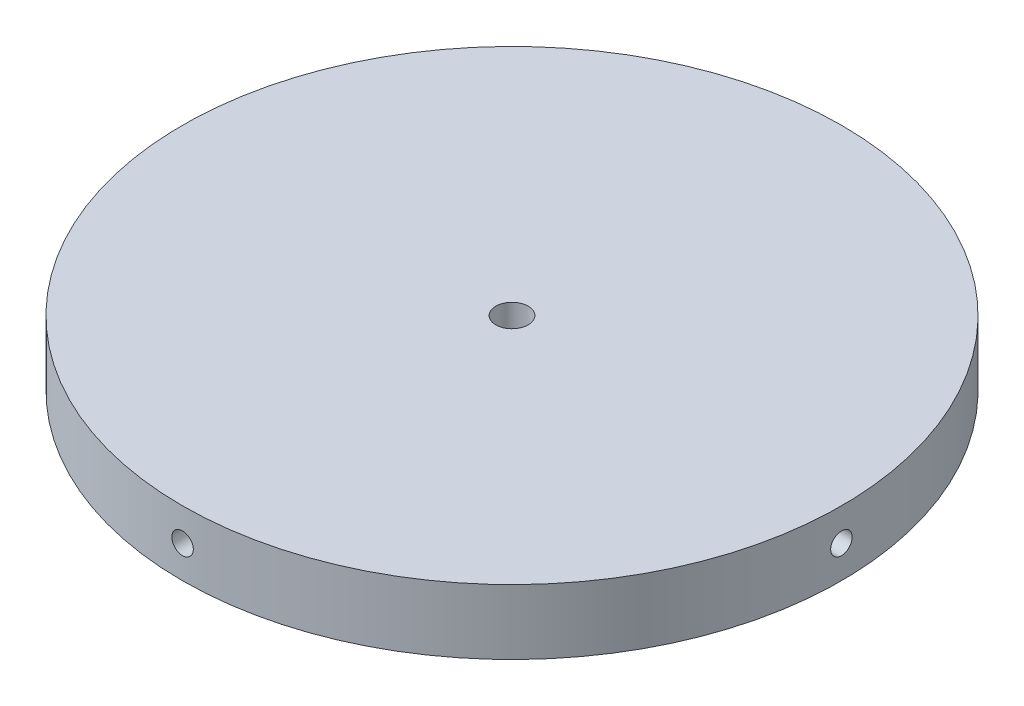
from build123d import *

# Parameters (mm, degrees)
SKETCH1_R                       = 50.7746
BOSS_EXTRUDE1_DEPTH             = 5
M6_TAPPED_HOLE1_D               = 5
M4_TAPPED_HOLE1_D               = 3.3
M4_TAPPED_HOLE1_DEPTH           = 10.1
M4_TAPPED_HOLE1_TIP             = 0.991420021
M4_TAPPED_HOLE1_ON_FACE_2_D     = 3.3
M4_TAPPED_HOLE1_ON_FACE_2_DEPTH = 10.1
M4_TAPPED_HOLE1_ON_FACE_2_TIP   = 0.991420021
M4_TAPPED_HOLE1_ON_FACE_3_D     = 3.3
M4_TAPPED_HOLE1_ON_FACE_3_DEPTH = 10.1
M4_TAPPED_HOLE1_ON_FACE_3_TIP   = 0.991420021
M4_TAPPED_HOLE1_ON_FACE_4_D     = 3.3
M4_TAPPED_HOLE1_ON_FACE_4_DEPTH = 10.1
M4_TAPPED_HOLE1_ON_FACE_4_TIP   = 0.991420021


with BuildPart() as part:
    # Sketch1 → Boss-Extrude1 (new, symmetric)
    with BuildSketch(Plane(origin=(0, 0, 0), x_dir=(1, 0, 0), z_dir=(0, 1, 0))):
        Circle(SKETCH1_R)
    extrude(amount=BOSS_EXTRUDE1_DEPTH, both=True)

    # M6 Tapped Hole1 (through all)
    with Locations(Plane(origin=(0, 5, 0), x_dir=(1, 0, 0), z_dir=(0, 1, 0))):
        with Locations((0, 0)):
            Hole(M6_TAPPED_HOLE1_D / 2)

    # M4 Tapped Hole1
    with Locations(Plane(origin=(0, 0, -50.7746), x_dir=(-1, 0, 0), z_dir=(0, 0, -1))):
        with Locations((0, 0)):
            Hole(M4_TAPPED_HOLE1_D / 2, depth=M4_TAPPED_HOLE1_DEPTH)
            with Locations((0, 0, -(M4_TAPPED_HOLE1_DEPTH + M4_TAPPED_HOLE1_TIP / 2))):  # 118° drill point
                Cone(0, M4_TAPPED_HOLE1_D / 2, M4_TAPPED_HOLE1_TIP, mode=Mode.SUBTRACT)

    # M4 Tapped Hole1 on face 2
    with Locations(Plane(origin=(-50.7746, 0, 0), x_dir=(0, 0, -1), z_dir=(-1, 0, 0))):
        with Locations((0, 0)):
            Hole(M4_TAPPED_HOLE1_ON_FACE_2_D / 2, depth=M4_TAPPED_HOLE1_ON_FACE_2_DEPTH)
            with Locations((0, 0, -(M4_TAPPED_HOLE1_ON_FACE_2_DEPTH + M4_TAPPED_HOLE1_ON_FACE_2_TIP / 2))):  # 118° drill point
                Cone(0, M4_TAPPED_HOLE1_ON_FACE_2_D / 2, M4_TAPPED_HOLE1_ON_FACE_2_TIP, mode=Mode.SUBTRACT)

    # M4 Tapped Hole1 on face 3
    with Locations(Plane.XY.offset(50.7746)):
        with Locations((0, 0)):
            Hole(M4_TAPPED_HOLE1_ON_FACE_3_D / 2, depth=M4_TAPPED_HOLE1_ON_FACE_3_DEPTH)
            with Locations((0, 0, -(M4_TAPPED_HOLE1_ON_FACE_3_DEPTH + M4_TAPPED_HOLE1_ON_FACE_3_TIP / 2))):  # 118° drill point
                Cone(0, M4_TAPPED_HOLE1_ON_FACE_3_D / 2, M4_TAPPED_HOLE1_ON_FACE_3_TIP, mode=Mode.SUBTRACT)

    # M4 Tapped Hole1 on face 4
    with Locations(Plane(origin=(50.7746, 0, 0), x_dir=(0, 0, 1), z_dir=(1, 0, 0))):
        with Locations((0, 0)):
            Hole(M4_TAPPED_HOLE1_ON_FACE_4_D / 2, depth=M4_TAPPED_HOLE1_ON_FACE_4_DEPTH)
            with Locations((0, 0, -(M4_TAPPED_HOLE1_ON_FACE_4_DEPTH + M4_TAPPED_HOLE1_ON_FACE_4_TIP / 2))):  # 118° drill point
                Cone(0, M4_TAPPED_HOLE1_ON_FACE_4_D / 2, M4_TAPPED_HOLE1_ON_FACE_4_TIP, mode=Mode.SUBTRACT)


solid = part.part
